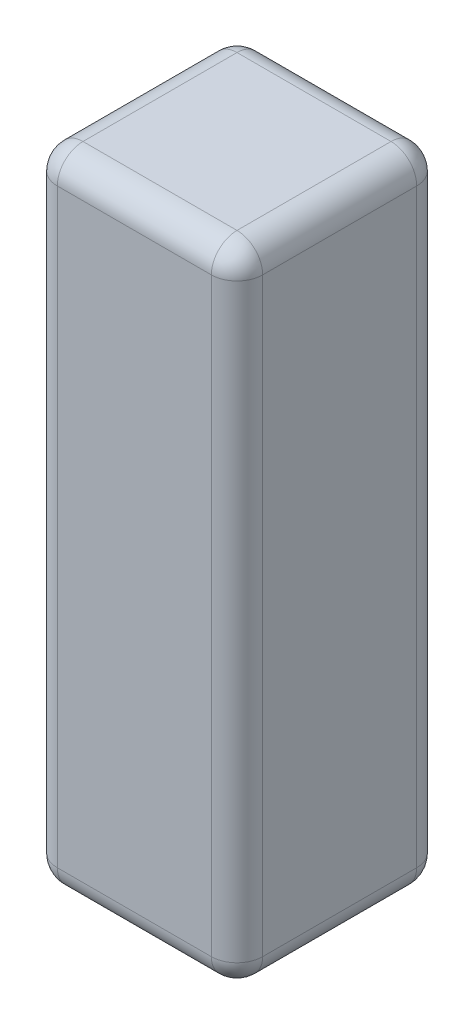
from build123d import *

# Parameters (mm, degrees)
SKETCH1_W           = 32
SKETCH1_H           = 100
BOSS_EXTRUDE1_DEPTH = 32
FILLET1_R           = 4


with BuildPart() as part:
    # Sketch1 → Boss-Extrude1 (new body)
    with BuildSketch(Plane.XY):
        with Locations((68.585871194, -163.776616404)):
            Rectangle(SKETCH1_W, SKETCH1_H)
    extrude(amount=-BOSS_EXTRUDE1_DEPTH)

    # Fillet1
    fillet1_edges = [part.edges().sort_by_distance(p)[0] for p in [
        (52.585871194, -213.776616404, -16),
        (84.585871194, -213.776616404, -16),
        (68.585871194, -213.776616404, 0),
        (52.585871194, -163.776616404, 0),
        (84.585871194, -163.776616404, 0),
        (52.585871194, -163.776616404, -32),
        (52.585871194, -113.776616404, -16),
        (68.585871194, -113.776616404, 0),
        (84.585871194, -113.776616404, -16),
        (68.585871194, -113.776616404, -32),
        (84.585871194, -163.776616404, -32),
        (68.585871194, -213.776616404, -32),
    ]]
    fillet(fillet1_edges, radius=FILLET1_R)


solid = part.part
